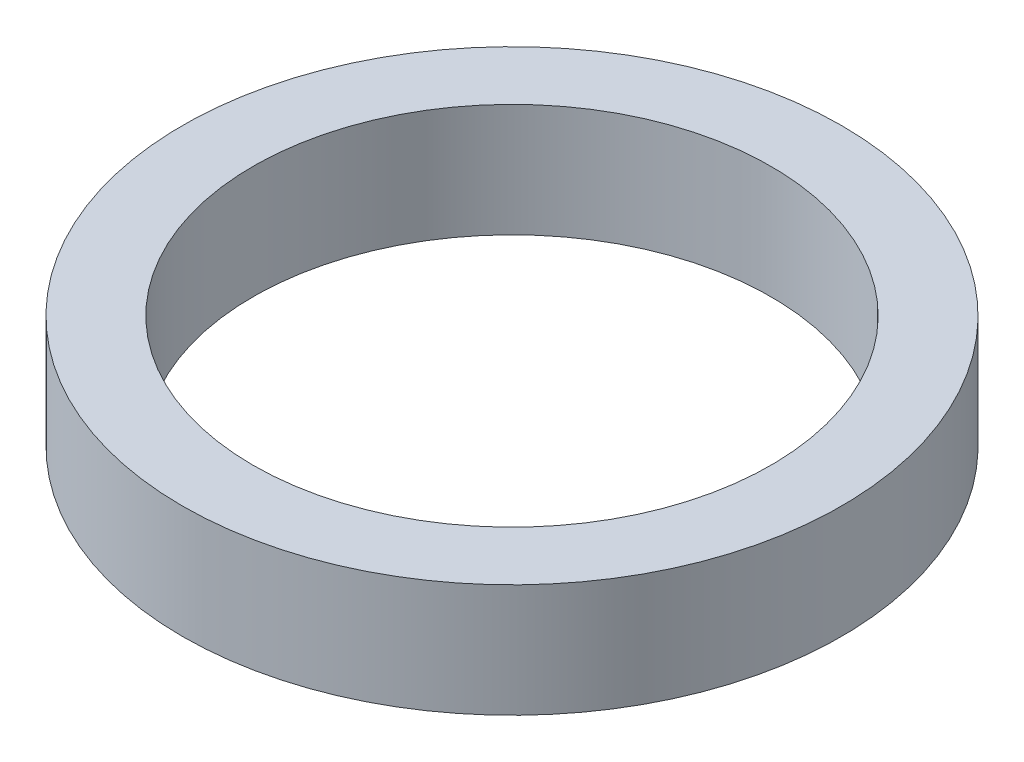
from build123d import *

# Parameters (mm, degrees)
SKETCH1_R           = 35
BOSS_EXTRUDE1_DEPTH = 12
SKETCH2_R           = 27.5
CUT_EXTRUDE1_DEPTH  = 51.931326313


with BuildPart() as part:
    # Sketch1 → Boss-Extrude1 (new body)
    with BuildSketch(Plane(origin=(0, 0, 0), x_dir=(1, 0, 0), z_dir=(0, 1, 0))):
        Circle(SKETCH1_R)
    extrude(amount=BOSS_EXTRUDE1_DEPTH)

    # Sketch2 → Cut-Extrude1 (cut, through all)
    with BuildSketch(Plane(origin=(0, 0, 0), x_dir=(1, 0, 0), z_dir=(0, 1, 0))):
        Circle(SKETCH2_R)
    extrude(amount=CUT_EXTRUDE1_DEPTH, mode=Mode.SUBTRACT)


solid = part.part
